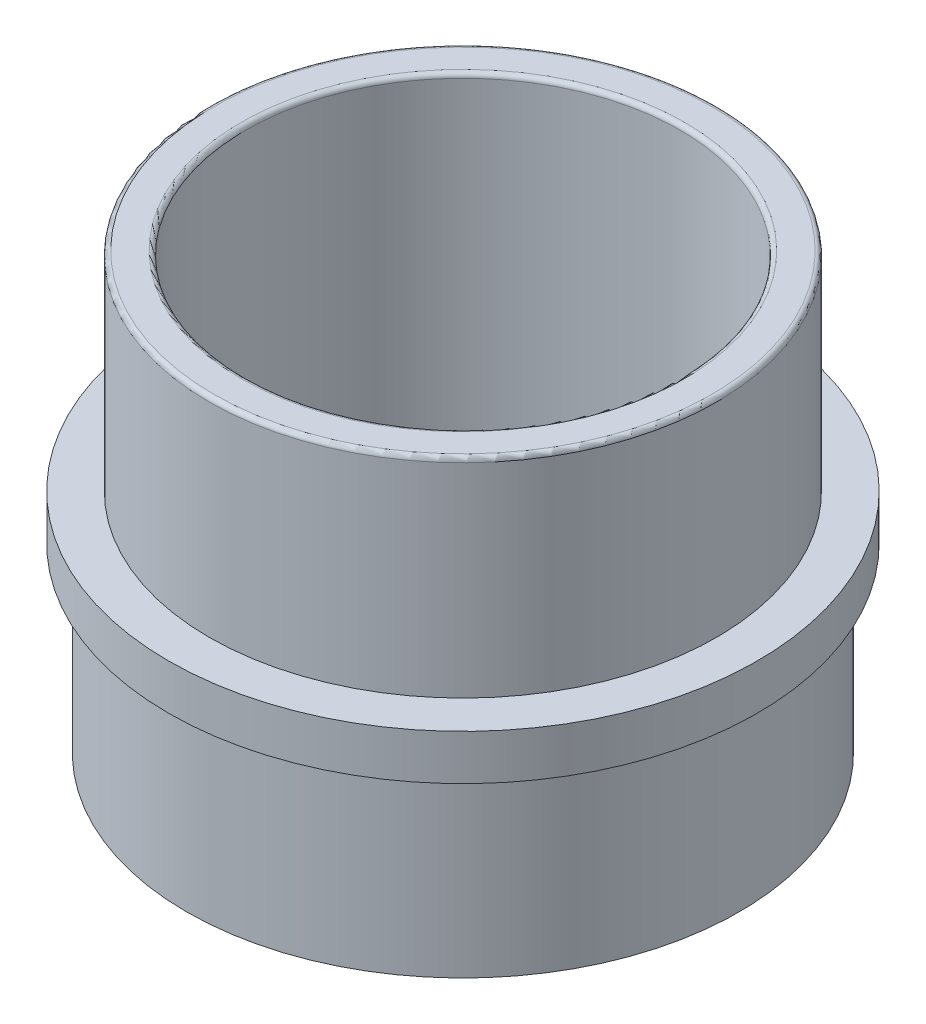
from build123d import *
from build123d.topology import SkipClean

# Parameters (mm, degrees)
SKETCH1_R                = 32.5
BOSS_EXTRUDE1_DEPTH      = 5
BOSS_EXTRUDE2_DEPTH      = 15
BOSS_EXTRUDE2_DEPTH_BACK = 5
BOSS_EXTRUDE2_START      = 5
SKETCH2_R                = 30.5
CUT_EXTRUDE3_START       = 10
SKETCH3_R                = 24
CUT_EXTRUDE3_DEPTH       = 41.124844139
CUT_EXTRUDE3_DRAFT       = -12
FILLET1_R                = 4
SKETCH4_R                = 24
CUT_EXTRUDE4_DEPTH       = 49.347699015
FILLET2_R                = 12
SKETCH5_R                = 28
SKETCH5_R_2              = 24
BOSS_EXTRUDE3_DEPTH      = 23
FILLET3_R                = 0.5


with BuildPart() as part:
    # Sketch1 → Boss-Extrude1 (new body)
    with BuildSketch(Plane(origin=(0, 0, 0), x_dir=(1, 0, 0), z_dir=(0, 1, 0))):
        with Locations(Location((0, 0, 0), (0, 0, 270))):
            Circle(SKETCH1_R)
    extrude(amount=BOSS_EXTRUDE1_DEPTH)

    # Sketch2 → Boss-Extrude2 (add, two sides: drawn at the far end of the back side and taken through both)
    with BuildSketch(Plane.XZ.offset(BOSS_EXTRUDE2_START - BOSS_EXTRUDE2_DEPTH_BACK)):
        with Locations(Location((0, 0, 0), (0, 0, 270))):
            Circle(SKETCH2_R)
    extrude(amount=BOSS_EXTRUDE2_DEPTH + BOSS_EXTRUDE2_DEPTH_BACK)


with BuildPart() as cut_extrude3_tool:
    # Sketch3 → Cut-Extrude3 (with draft: the straight prism first)
    with BuildSketch(Plane(origin=(0, 0, 0), x_dir=(-1, 0, 0), z_dir=(0, -1, 0)).offset(CUT_EXTRUDE3_START)):
        Circle(SKETCH3_R)
    extrude(amount=CUT_EXTRUDE3_DEPTH)
    # Cut-Extrude3: the draft: its side faces are tilted about the plane it starts from
    cut_extrude3_sides = [cut_extrude3_tool.faces().sort_by_distance(p)[0] for p in [
        (24, -30.56242207, 0),
    ]]
    draft(cut_extrude3_sides, Plane(origin=(0, 0, 0), x_dir=(-1, 0, 0), z_dir=(0, -1, 0)).offset(CUT_EXTRUDE3_START), CUT_EXTRUDE3_DRAFT)


with BuildPart() as part_1:
    add(part.part)

    # Cut-Extrude3: cut by cut_extrude3_tool
    add(cut_extrude3_tool.part, mode=Mode.SUBTRACT)

    # Fillet1
    fillet1_edges = [part_1.edges().sort_by_distance(p)[0] for p in [
        (26.125565617, -20, 0),
    ]]
    fillet(fillet1_edges, radius=FILLET1_R)

    # Sketch4 → Cut-Extrude4 (cut, through all)
    with BuildSketch(Plane.XZ.offset(10)):
        with Locations(Location((0, 0, 0), (0, 0, 270))):
            Circle(SKETCH4_R)
    extrude(amount=-CUT_EXTRUDE4_DEPTH, mode=Mode.SUBTRACT)

    # Fillet2
    fillet2_edges = [part_1.edges().sort_by_distance(p)[0] for p in [
        (-16.970562748, -10, -16.970562748),
    ]]
    fillet(fillet2_edges, radius=FILLET2_R)

    # Sketch5 → Boss-Extrude3 (add)
    with SkipClean():  # the faces are left unmerged after this step: merging them gives an invalid solid
        with BuildSketch(Plane(origin=(0, 5, 0), x_dir=(1, 0, 0), z_dir=(0, 1, 0))):
            with Locations(Location((0, 0, 0), (0, 0, 270))):
                Circle(SKETCH5_R)
            with Locations(Location((0, 0, 0), (0, 0, 270))):
                Circle(SKETCH5_R_2, mode=Mode.SUBTRACT)
        extrude(amount=BOSS_EXTRUDE3_DEPTH)
    add(part_1.part.scale(1), mode=Mode.REPLACE)  # the faces are merged on a copy

    # Fillet3
    fillet3_edges = [part_1.edges().sort_by_distance(p)[0] for p in [
        (0, 28, -28),
        (0, 28, -24),
    ]]
    fillet(fillet3_edges, radius=FILLET3_R)


solid = part_1.part
